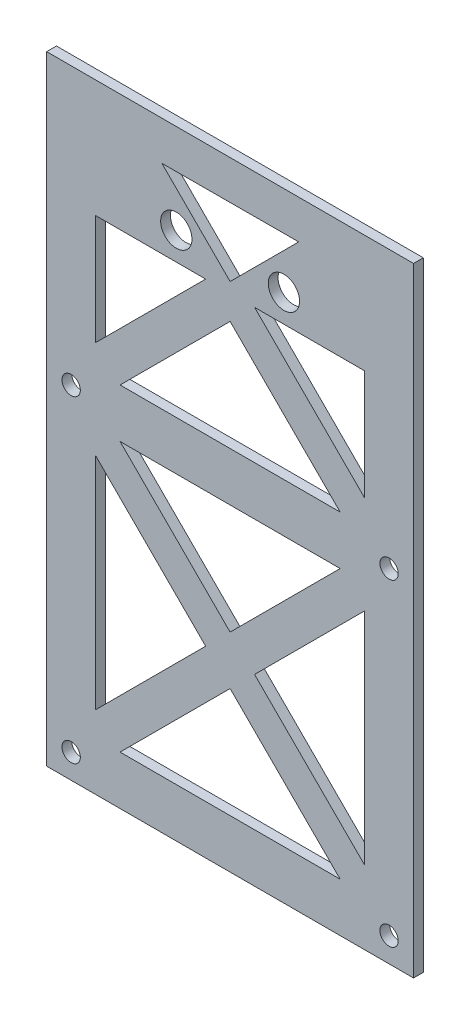
from build123d import *

# Parameters (mm, degrees)
SKETCH1_W           = 75
SKETCH1_H           = 126.51894577
SKETCH1_R           = 1.875
SKETCH1_R_2         = 3.2
BOSS_EXTRUDE2_DEPTH = 2


with BuildPart() as part:
    # Sketch1 → Boss-Extrude2 (new body)
    with BuildSketch(Plane.XY):
        with Locations((0, -201.288893998)):
            Rectangle(SKETCH1_W, SKETCH1_H)
        with Locations((32.5, -259.548366883)):
            Circle(SKETCH1_R, mode=Mode.SUBTRACT)
        with Locations((-32.5, -259.548366883)):
            Circle(SKETCH1_R, mode=Mode.SUBTRACT)
        with Locations((-32.5, -194.548366883)):
            Circle(SKETCH1_R, mode=Mode.SUBTRACT)
        with Locations((32.5, -194.548366883)):
            Circle(SKETCH1_R, mode=Mode.SUBTRACT)
        with Locations((11, -156.389421113)):
            Circle(SKETCH1_R_2, mode=Mode.SUBTRACT)
        with Locations((-11, -156.389421113)):
            Circle(SKETCH1_R_2, mode=Mode.SUBTRACT)
        Polygon((5, -162.048366883), (27.5, -162.048366883), (27.5, -184.548366883), align=None, mode=Mode.SUBTRACT)
        Polygon((-27.5, -204.548366883), (-27.5, -249.548366883), (-5, -227.048366883), align=None, mode=Mode.SUBTRACT)
        Polygon((-22.5, -254.548366883), (22.5, -254.548366883), (0, -232.048366883), align=None, mode=Mode.SUBTRACT)
        Polygon((27.5, -249.548366883), (27.5, -204.548366883), (5, -227.048366883), align=None, mode=Mode.SUBTRACT)
        Polygon((-5, -162.048366883), (-27.5, -162.048366883), (-27.5, -184.548366883), align=None, mode=Mode.SUBTRACT)
        Polygon((-22.5, -199.548366883), (22.5, -199.548366883), (0, -222.048366883), align=None, mode=Mode.SUBTRACT)
        Polygon((-22.5, -189.548366883), (22.5, -189.548366883), (0, -167.048366883), align=None, mode=Mode.SUBTRACT)
        Polygon((14.024331064, -145.954035819), (0, -159.978366883), (-13.95827912, -146.020087763), align=None, mode=Mode.SUBTRACT)
    extrude(amount=BOSS_EXTRUDE2_DEPTH)


solid = part.part
